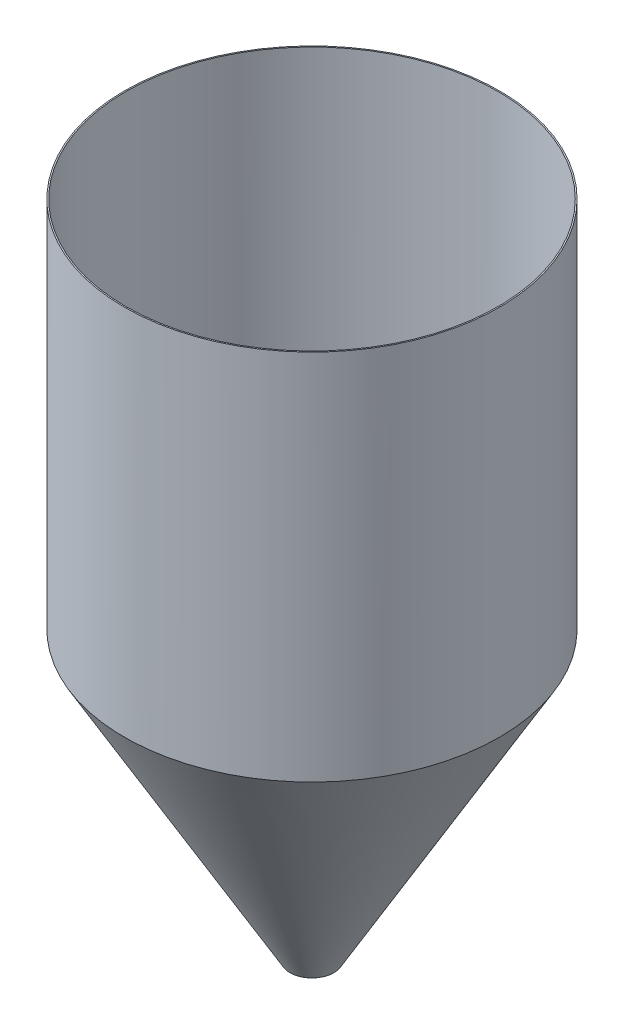
from build123d import *

# Parameters (mm, degrees)
SKETCH7_R           = 230.1875
SKETCH7_R_2         = 228.6
BOSS_EXTRUDE1_DEPTH = 457.2


with BuildPart() as part:
    # Sketch7 → Boss-Extrude1 (new body)
    with BuildSketch(Plane(origin=(0, 0, 0), x_dir=(1, 0, 0), z_dir=(0, 1, 0))):
        Circle(SKETCH7_R)
        Circle(SKETCH7_R_2, mode=Mode.SUBTRACT)
    extrude(amount=BOSS_EXTRUDE1_DEPTH)

    # Sketch8 → Revolve1 (revolve)
    with BuildSketch(Plane.XY):
        Polygon((228.6, 0), (230.1875, 0), (26.9875, -351.952724098), (25.4, -351.952724098), align=None)
    revolve(axis=Axis((0, 0, 0), (0, -1, 0)))


solid = part.part
